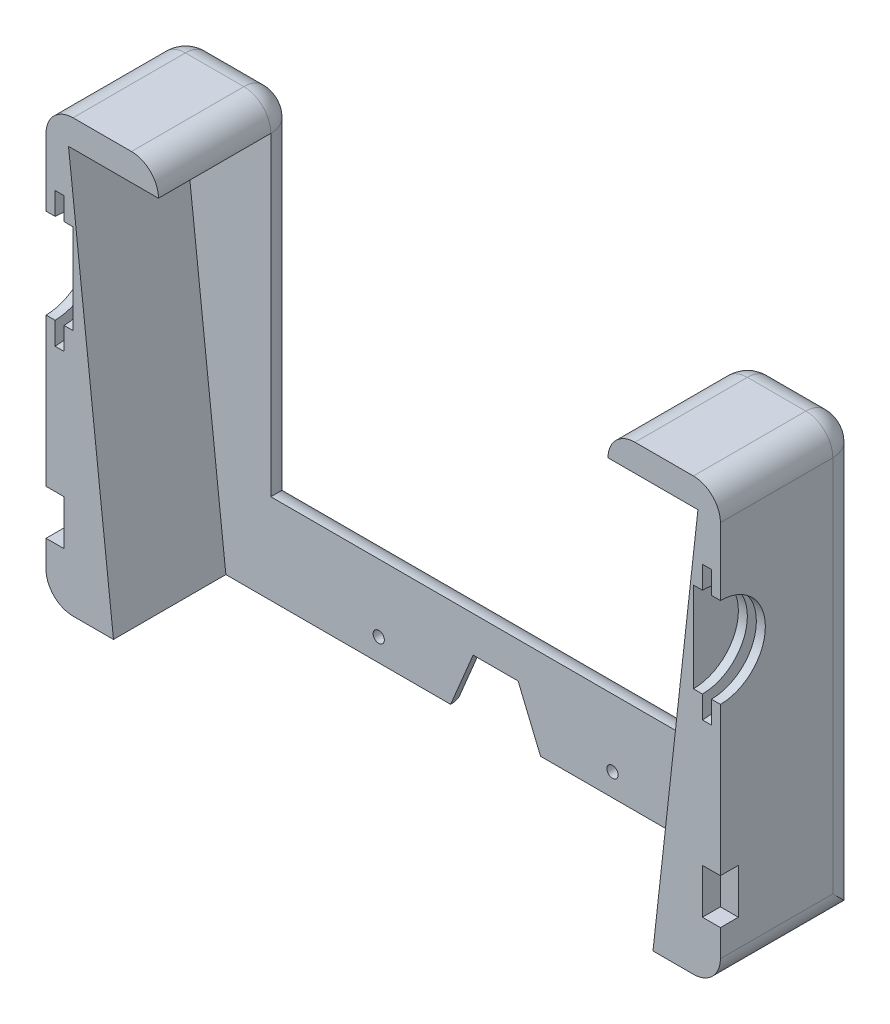
from build123d import *

# Parameters (mm, degrees)
SKETCH1_W           = 75
SKETCH1_H           = 48
BOSS_EXTRUDE1_DEPTH = 7.75
CUT_EXTRUDE1_DEPTH  = 12.5
SKETCH3_W           = 50
SKETCH3_H           = 38
CUT_EXTRUDE2_DEPTH  = 48.924419663
SKETCH4_R           = 0.625
CUT_EXTRUDE3_DEPTH  = 12.5
FILLET1_R           = 3
SKETCH7_R           = 1.25
CUT_EXTRUDE4_DEPTH  = 1
SKETCH8_W           = 2
SKETCH8_H           = 5
CUT_EXTRUDE5_DEPTH  = 2
SKETCH9_R           = 5
CUT_EXTRUDE6_DEPTH  = 3
SKETCH10_R          = 7.5
CUT_EXTRUDE7_DEPTH  = 0.5


with BuildPart() as part:
    # Sketch1 → Boss-Extrude1 (new, symmetric)
    with BuildSketch(Plane.XY):
        with Locations((0, 1.5)):
            Rectangle(SKETCH1_W, SKETCH1_H)
    extrude(amount=BOSS_EXTRUDE1_DEPTH, both=True)

    # Sketch2 → Cut-Extrude1 (cut)
    with BuildSketch(Plane.XY.offset(7.75)):
        Polygon((-35, 22.5), (35, 22.5), (30, -22.5), (-30, -22.5), align=None)
    extrude(amount=-CUT_EXTRUDE1_DEPTH, mode=Mode.SUBTRACT)

    # Sketch3 → Cut-Extrude2 (cut, through all)
    with BuildSketch(Plane(origin=(0, 0, -7.75), x_dir=(-1, 0, 0), z_dir=(0, 0, -1))):
        with Locations((0, 6.5)):
            Rectangle(SKETCH3_W, SKETCH3_H)
    extrude(amount=-CUT_EXTRUDE2_DEPTH, mode=Mode.SUBTRACT)

    # Sketch4 → Cut-Extrude3 (cut)
    with BuildSketch(Plane.XY):
        with Locations((-13, -20)):
            Circle(SKETCH4_R)
        with Locations((13, -20)):
            Circle(SKETCH4_R)
        Polygon((2.5, -16.5), (5, -22.5), (-5, -22.5), (-2.5, -16.5), align=None)
    extrude(amount=-CUT_EXTRUDE3_DEPTH, mode=Mode.SUBTRACT)

    # Fillet1
    # the kernel refuses this fillet: 3 mm, written as the material it takes off along each edge
    with BuildSketch(Plane(origin=(34.5, 22.5, -4.75), x_dir=(1, 0, 0), z_dir=(0, 0, -1))) as fillet1_piece_1_section:
        Polygon((0, 0), (FILLET1_R, 0), (FILLET1_R, -FILLET1_R), (0, -FILLET1_R), align=None)
    fillet1_piece_1 = extrude(amount=FILLET1_R, mode=Mode.PRIVATE)
    fillet1_piece_1 = fillet1_piece_1 - Plane(origin=(34.5, 22.5, -4.75), x_dir=(-0.7071067811865475, -0.7071067811865475, 0), z_dir=(0, 0, -1)) * Sphere(FILLET1_R, mode=Mode.PRIVATE)
    add(fillet1_piece_1, mode=Mode.SUBTRACT)
    with BuildSketch(Plane(origin=(28, 22.5, -4.75), x_dir=(0, 0, -1), z_dir=(-1, 0, 0))) as fillet1_piece_2_section:
        Polygon((0, 0), (FILLET1_R, 0), (FILLET1_R, -FILLET1_R), (0, -FILLET1_R), align=None)
    fillet1_piece_2 = extrude(amount=FILLET1_R, mode=Mode.PRIVATE)
    fillet1_piece_2 = fillet1_piece_2 - Plane(origin=(28, 22.5, -4.75), x_dir=(0, -0.7071067811865475, 0.7071067811865475), z_dir=(-1, 0, 0)) * Sphere(FILLET1_R, mode=Mode.PRIVATE)
    add(fillet1_piece_2, mode=Mode.SUBTRACT)
    with BuildSketch(Plane(origin=(-28, 22.5, -4.75), x_dir=(1, 0, 0), z_dir=(0, 1, 0))) as fillet1_piece_3_section:
        Polygon((0, 0), (FILLET1_R, 0), (FILLET1_R, FILLET1_R), (0, FILLET1_R), align=None)
    fillet1_piece_3 = extrude(amount=FILLET1_R, mode=Mode.PRIVATE)
    fillet1_piece_3 = fillet1_piece_3 - Plane(origin=(-28, 22.5, -4.75), x_dir=(-0.7071067811865475, 0, 0.7071067811865475), z_dir=(0, 1, 0)) * Sphere(FILLET1_R, mode=Mode.PRIVATE)
    add(fillet1_piece_3, mode=Mode.SUBTRACT)
    with BuildSketch(Plane(origin=(-34.5, 22.5, -4.75), x_dir=(-1, 0, 0), z_dir=(0, 1, 0))) as fillet1_piece_4_section:
        Polygon((0, 0), (FILLET1_R, 0), (FILLET1_R, -FILLET1_R), (0, -FILLET1_R), align=None)
    fillet1_piece_4 = extrude(amount=FILLET1_R, mode=Mode.PRIVATE)
    fillet1_piece_4 = fillet1_piece_4 - Plane(origin=(-34.5, 22.5, -4.75), x_dir=(0.7071067811865475, 0, 0.7071067811865475), z_dir=(0, 1, 0)) * Sphere(FILLET1_R, mode=Mode.PRIVATE)
    add(fillet1_piece_4, mode=Mode.SUBTRACT)
    with BuildSketch(Plane(origin=(0.384615385, -9.576923077, -7.75), x_dir=(-0.9230769230769234, 0.3846153846153842, 0), z_dir=(-0.3846153846153842, -0.9230769230769232, 0))) as fillet1_piece_5_section:
        with BuildLine():
            CenterArc((FILLET1_R, -FILLET1_R), FILLET1_R, 90, 90)
            Line((0, -FILLET1_R), (0, 0))
            Line((0, 0), (FILLET1_R, 0))
        make_face()
    fillet1_piece_5 = extrude(amount=21.5, mode=Mode.PRIVATE)
    fillet1_piece_5 = split(fillet1_piece_5, bisect_by=Plane(origin=(-5.860923252, -16.5, -7.063308452), z_dir=(0, -1, 0)), keep=Keep.TOP, mode=Mode.PRIVATE)
    add(fillet1_piece_5, mode=Mode.SUBTRACT)
    with BuildSketch(Plane(origin=(7.884615385, -29.423076923, -7.75), x_dir=(0.923076923076923, 0.3846153846153847, 0), z_dir=(-0.3846153846153847, 0.9230769230769231, 0))) as fillet1_piece_6_section:
        with BuildLine():
            CenterArc((FILLET1_R, -FILLET1_R), FILLET1_R, 90, 90)
            Line((0, -FILLET1_R), (0, 0))
            Line((0, 0), (FILLET1_R, 0))
        make_face()
    fillet1_piece_6 = extrude(amount=21.5, mode=Mode.PRIVATE)
    fillet1_piece_6 = split(fillet1_piece_6, bisect_by=Plane(origin=(5.860923252, -16.5, -7.063308452), z_dir=(0, -1, 0)), keep=Keep.TOP, mode=Mode.PRIVATE)
    add(fillet1_piece_6, mode=Mode.SUBTRACT)
    with BuildSketch(Plane(origin=(10, -16.5, -7.75), x_dir=(0, 1, 0), z_dir=(-1, 0, 0))) as fillet1_piece_7_section:
        with BuildLine():
            CenterArc((FILLET1_R, -FILLET1_R), FILLET1_R, 90, 90)
            Line((0, -FILLET1_R), (0, 0))
            Line((0, 0), (FILLET1_R, 0))
        make_face()
    fillet1_piece_7 = extrude(amount=20, mode=Mode.PRIVATE)
    fillet1_piece_7 = split(fillet1_piece_7, bisect_by=Plane(origin=(-1.916956866, -15.100696479, -7.024372447), z_dir=(0.9230769230769232, -0.3846153846153842, 0)), keep=Keep.TOP, mode=Mode.PRIVATE)
    fillet1_piece_7 = split(fillet1_piece_7, bisect_by=Plane(origin=(1.916956866, -15.100696479, -7.024372447), z_dir=(-0.9230769230769231, -0.3846153846153847, 0)), keep=Keep.TOP, mode=Mode.PRIVATE)
    add(fillet1_piece_7, mode=Mode.SUBTRACT)
    with BuildSketch(Plane(origin=(-25, -12.5, -7.75), x_dir=(0, -1, 0), z_dir=(1, 0, 0))) as fillet1_piece_8:
        with BuildLine():
            CenterArc((FILLET1_R, -FILLET1_R), FILLET1_R, 90, 90)
            Line((0, -FILLET1_R), (0, 0))
            Line((0, 0), (FILLET1_R, 0))
        make_face()
    extrude(amount=50, mode=Mode.SUBTRACT)
    with BuildSketch(Plane(origin=(37.5, 25.5, 15.25), x_dir=(0, -1, 0), z_dir=(0, 0, -1)), Plane(origin=(-25, 25.5, -4.75), x_dir=(-1, 0, 0), z_dir=(0, 0, 1))) as fillet1_piece_9:
        with BuildLine():
            CenterArc((FILLET1_R, FILLET1_R), FILLET1_R, 180, 90)
            Line((0, FILLET1_R), (0, 0))
            Line((0, 0), (FILLET1_R, 0))
        make_face()
    extrude(amount=20, mode=Mode.SUBTRACT)
    with BuildSketch(Plane(origin=(28, 25.5, -7.75), x_dir=(0, -1, 0), z_dir=(1, 0, 0))) as fillet1_piece_10:
        with BuildLine():
            CenterArc((FILLET1_R, -FILLET1_R), FILLET1_R, 90, 90)
            Line((0, -FILLET1_R), (0, 0))
            Line((0, 0), (FILLET1_R, 0))
        make_face()
    extrude(amount=6.5, mode=Mode.SUBTRACT)
    with BuildSketch(Plane(origin=(25, 25.5, -4.75), x_dir=(1, 0, 0), z_dir=(0, 0, 1)), Plane(origin=(-37.5, 25.5, -4.75), x_dir=(1, 0, 0), z_dir=(0, 0, 1))) as fillet1_piece_11:
        with BuildLine():
            CenterArc((FILLET1_R, -FILLET1_R), FILLET1_R, 90, 90)
            Line((0, -FILLET1_R), (0, 0))
            Line((0, 0), (FILLET1_R, 0))
        make_face()
    extrude(amount=20, mode=Mode.SUBTRACT)
    with BuildSketch(Plane(origin=(-34.5, 25.5, -7.75), x_dir=(0, 0, 1), z_dir=(1, 0, 0))) as fillet1_piece_12:
        with BuildLine():
            CenterArc((FILLET1_R, FILLET1_R), FILLET1_R, 180, 90)
            Line((0, FILLET1_R), (0, 0))
            Line((0, 0), (FILLET1_R, 0))
        make_face()
    extrude(amount=6.5, mode=Mode.SUBTRACT)
    with BuildSketch(Plane(origin=(-37.5, -30, -7.75), x_dir=(0, 0, 1), z_dir=(0, 1, 0))) as fillet1_piece_13:
        with BuildLine():
            CenterArc((FILLET1_R, FILLET1_R), FILLET1_R, 180, 90)
            Line((0, FILLET1_R), (0, 0))
            Line((0, 0), (FILLET1_R, 0))
        make_face()
    extrude(amount=52.5, mode=Mode.SUBTRACT)
    with BuildSketch(Plane(origin=(-25, 22.5, -7.75), x_dir=(0, 0, 1), z_dir=(0, -1, 0))) as fillet1_piece_14:
        with BuildLine():
            CenterArc((FILLET1_R, FILLET1_R), FILLET1_R, 180, 90)
            Line((0, FILLET1_R), (0, 0))
            Line((0, 0), (FILLET1_R, 0))
        make_face()
    extrude(amount=35, mode=Mode.SUBTRACT)
    with BuildSketch(Plane(origin=(25, -12.5, -7.75), x_dir=(1, 0, 0), z_dir=(0, 1, 0))) as fillet1_piece_15:
        with BuildLine():
            CenterArc((FILLET1_R, -FILLET1_R), FILLET1_R, 90, 90)
            Line((0, -FILLET1_R), (0, 0))
            Line((0, 0), (FILLET1_R, 0))
        make_face()
    extrude(amount=35, mode=Mode.SUBTRACT)
    with BuildSketch(Plane(origin=(37.5, 22.5, -7.75), x_dir=(-1, 0, 0), z_dir=(0, -1, 0))) as fillet1_piece_16:
        with BuildLine():
            CenterArc((FILLET1_R, -FILLET1_R), FILLET1_R, 90, 90)
            Line((0, -FILLET1_R), (0, 0))
            Line((0, 0), (FILLET1_R, 0))
        make_face()
    extrude(amount=52.5, mode=Mode.SUBTRACT)
    with BuildSketch(Plane(origin=(-37.5, -22.5, -15.25), x_dir=(0, 1, 0), z_dir=(0, 0, 1))) as fillet1_piece_17:
        with BuildLine():
            CenterArc((FILLET1_R, -FILLET1_R), FILLET1_R, 90, 90)
            Line((0, -FILLET1_R), (0, 0))
            Line((0, 0), (FILLET1_R, 0))
        make_face()
    extrude(amount=30.5, mode=Mode.SUBTRACT)
    with BuildSketch(Plane(origin=(37.5, -22.5, 15.25), x_dir=(-1, 0, 0), z_dir=(0, 0, -1))) as fillet1_piece_18:
        with BuildLine():
            CenterArc((FILLET1_R, FILLET1_R), FILLET1_R, 180, 90)
            Line((0, FILLET1_R), (0, 0))
            Line((0, 0), (FILLET1_R, 0))
        make_face()
    extrude(amount=30.5, mode=Mode.SUBTRACT)
    with BuildSketch(Plane(origin=(0.384615385, -9.576923077, -7.75), x_dir=(-0.9230769230769234, 0.3846153846153842, 0), z_dir=(-0.3846153846153842, -0.9230769230769232, 0))) as fillet1_piece_19a_section:
        with BuildLine():
            CenterArc((FILLET1_R, -FILLET1_R), FILLET1_R, 90, 90)
            Line((0, -FILLET1_R), (0, 0))
            Line((0, 0), (FILLET1_R, 0))
        make_face()
    fillet1_piece_19a = extrude(amount=21.5, mode=Mode.PRIVATE)
    fillet1_piece_19a = split(fillet1_piece_19a, bisect_by=Plane(origin=(-1.76151966, -16.5, -7.084043842), z_dir=(0, 1, 0)), keep=Keep.TOP, mode=Mode.PRIVATE)
    with BuildSketch(Plane(origin=(10, -16.5, -7.75), x_dir=(0, 1, 0), z_dir=(-1, 0, 0))) as fillet1_piece_19b_section:
        with BuildLine():
            CenterArc((FILLET1_R, -FILLET1_R), FILLET1_R, 90, 90)
            Line((0, -FILLET1_R), (0, 0))
            Line((0, 0), (FILLET1_R, 0))
        make_face()
    fillet1_piece_19b = extrude(amount=20, mode=Mode.PRIVATE)
    fillet1_piece_19b = split(fillet1_piece_19b, bisect_by=Plane(origin=(-2.7840309, -17.18167416, -7.084043842), z_dir=(-0.9230769230769232, 0.3846153846153842, 0)), keep=Keep.TOP, mode=Mode.PRIVATE)
    fillet1_piece_19 = fillet1_piece_19a & fillet1_piece_19b
    add(fillet1_piece_19, mode=Mode.SUBTRACT)
    with BuildSketch(Plane(origin=(10, -16.5, -7.75), x_dir=(0, 1, 0), z_dir=(-1, 0, 0))) as fillet1_piece_20a_section:
        with BuildLine():
            CenterArc((FILLET1_R, -FILLET1_R), FILLET1_R, 90, 90)
            Line((0, -FILLET1_R), (0, 0))
            Line((0, 0), (FILLET1_R, 0))
        make_face()
    fillet1_piece_20a = extrude(amount=20, mode=Mode.PRIVATE)
    fillet1_piece_20a = split(fillet1_piece_20a, bisect_by=Plane(origin=(2.7840309, -17.18167416, -7.084043842), z_dir=(0.9230769230769231, 0.3846153846153847, 0)), keep=Keep.TOP, mode=Mode.PRIVATE)
    with BuildSketch(Plane(origin=(7.884615385, -29.423076923, -7.75), x_dir=(0.923076923076923, 0.3846153846153847, 0), z_dir=(-0.3846153846153847, 0.9230769230769231, 0))) as fillet1_piece_20b_section:
        with BuildLine():
            CenterArc((FILLET1_R, -FILLET1_R), FILLET1_R, 90, 90)
            Line((0, -FILLET1_R), (0, 0))
            Line((0, 0), (FILLET1_R, 0))
        make_face()
    fillet1_piece_20b = extrude(amount=21.5, mode=Mode.PRIVATE)
    fillet1_piece_20b = split(fillet1_piece_20b, bisect_by=Plane(origin=(1.76151966, -16.5, -7.084043842), z_dir=(0, 1, 0)), keep=Keep.TOP, mode=Mode.PRIVATE)
    fillet1_piece_20 = fillet1_piece_20a & fillet1_piece_20b
    add(fillet1_piece_20, mode=Mode.SUBTRACT)
    with BuildSketch(Plane(origin=(-25, 22.5, -7.75), x_dir=(0, 0, 1), z_dir=(0, -1, 0))) as fillet1_piece_21a_section:
        with BuildLine():
            CenterArc((FILLET1_R, FILLET1_R), FILLET1_R, 180, 90)
            Line((0, FILLET1_R), (0, 0))
            Line((0, 0), (FILLET1_R, 0))
        make_face()
    fillet1_piece_21a = extrude(amount=42.5, mode=Mode.PRIVATE)
    fillet1_piece_21a = split(fillet1_piece_21a, bisect_by=Plane(origin=(-25.679185343, -12.5, -7.070814657), z_dir=(0, -1, 0)), keep=Keep.TOP, mode=Mode.PRIVATE)
    with BuildSketch(Plane(origin=(-32.5, -12.5, -7.75), x_dir=(0, -1, 0), z_dir=(1, 0, 0))) as fillet1_piece_21b_section:
        with BuildLine():
            CenterArc((FILLET1_R, -FILLET1_R), FILLET1_R, 90, 90)
            Line((0, -FILLET1_R), (0, 0))
            Line((0, 0), (FILLET1_R, 0))
        make_face()
    fillet1_piece_21b = extrude(amount=57.5, mode=Mode.PRIVATE)
    fillet1_piece_21b = split(fillet1_piece_21b, bisect_by=Plane(origin=(-25, -13.179185343, -7.070814657), z_dir=(-1, 0, 0)), keep=Keep.TOP, mode=Mode.PRIVATE)
    fillet1_piece_21 = fillet1_piece_21a & fillet1_piece_21b
    add(fillet1_piece_21, mode=Mode.SUBTRACT)
    with BuildSketch(Plane(origin=(25, -20, -7.75), x_dir=(1, 0, 0), z_dir=(0, 1, 0))) as fillet1_piece_22a_section:
        with BuildLine():
            CenterArc((FILLET1_R, -FILLET1_R), FILLET1_R, 90, 90)
            Line((0, -FILLET1_R), (0, 0))
            Line((0, 0), (FILLET1_R, 0))
        make_face()
    fillet1_piece_22a = extrude(amount=42.5, mode=Mode.PRIVATE)
    fillet1_piece_22a = split(fillet1_piece_22a, bisect_by=Plane(origin=(25.679185343, -12.5, -7.070814657), z_dir=(0, -1, 0)), keep=Keep.TOP, mode=Mode.PRIVATE)
    with BuildSketch(Plane(origin=(-25, -12.5, -7.75), x_dir=(0, -1, 0), z_dir=(1, 0, 0))) as fillet1_piece_22b_section:
        with BuildLine():
            CenterArc((FILLET1_R, -FILLET1_R), FILLET1_R, 90, 90)
            Line((0, -FILLET1_R), (0, 0))
            Line((0, 0), (FILLET1_R, 0))
        make_face()
    fillet1_piece_22b = extrude(amount=57.5, mode=Mode.PRIVATE)
    fillet1_piece_22b = split(fillet1_piece_22b, bisect_by=Plane(origin=(25, -13.179185343, -7.070814657), z_dir=(1, 0, 0)), keep=Keep.TOP, mode=Mode.PRIVATE)
    fillet1_piece_22 = fillet1_piece_22a & fillet1_piece_22b
    add(fillet1_piece_22, mode=Mode.SUBTRACT)

    # Sketch7 → Cut-Extrude4 (cut)
    with BuildSketch(Plane(origin=(0, 0, -7.75), x_dir=(-1, 0, 0), z_dir=(0, 0, -1))):
        with Locations((-13, -20)):
            Circle(SKETCH7_R)
        with Locations(Location((13, -20, 0), (0, 0, 180))):
            Circle(SKETCH7_R)
    extrude(amount=-CUT_EXTRUDE4_DEPTH, mode=Mode.SUBTRACT)

    # Sketch8 → Cut-Extrude5 (cut)
    with BuildSketch(Plane.XY.offset(7.75)):
        with Locations((-36.5, -14)):
            Rectangle(SKETCH8_W, SKETCH8_H)
        with Locations((36.5, -14)):
            Rectangle(SKETCH8_W, SKETCH8_H)
    extrude(amount=-CUT_EXTRUDE5_DEPTH, mode=Mode.SUBTRACT)

    # Sketch9 → Cut-Extrude6 (cut)
    with BuildSketch(Plane.ZY.offset(37.5)):
        with Locations((7.75, 10)):
            Circle(SKETCH9_R)
    cut_extrude6 = extrude(amount=-CUT_EXTRUDE6_DEPTH, mode=Mode.SUBTRACT)

    # Sketch10 → Cut-Extrude7 (cut, symmetric)
    with BuildSketch(Plane.ZY.offset(36)):
        with Locations((7.75, 10)):
            Circle(SKETCH10_R)
    cut_extrude7 = extrude(amount=CUT_EXTRUDE7_DEPTH, both=True, mode=Mode.SUBTRACT)

    # Mirror1: Cut-Extrude6, Cut-Extrude7 across plane
    add(cut_extrude6.mirror(Plane(origin=(0, 0, 0), x_dir=(0, 0, 1), z_dir=(1, 0, 0))), mode=Mode.SUBTRACT)
    add(cut_extrude7.mirror(Plane(origin=(0, 0, 0), x_dir=(0, 0, 1), z_dir=(1, 0, 0))), mode=Mode.SUBTRACT)


solid = part.part
